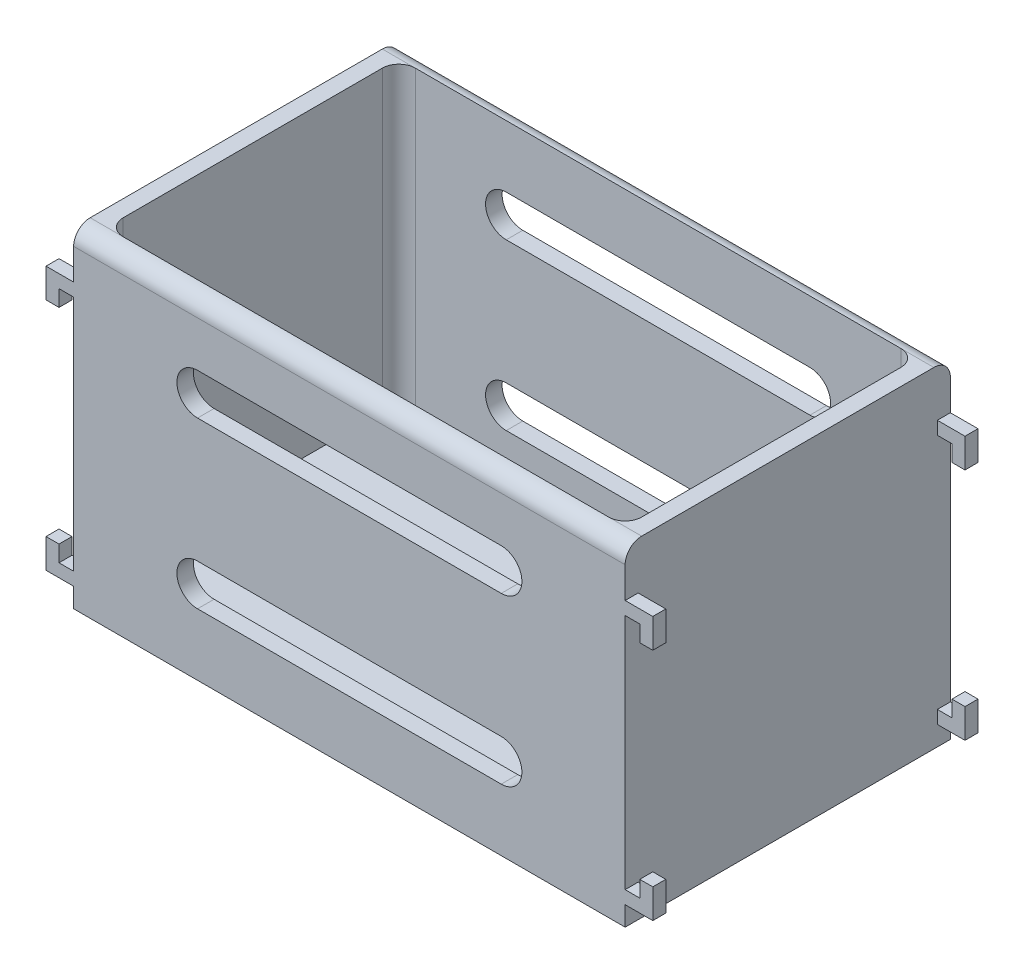
from build123d import *

# Parameters (mm, degrees)
SKETCH1_W           = 79.710080102
SKETCH1_H           = 44.920000076
BOSS_EXTRUDE1_DEPTH = 5
SKETCH3_W           = 84.790080102
SKETCH3_H           = 50.000000076
SKETCH3_W_2         = 79.710080102
SKETCH3_H_2         = 44.920000076
BOSS_EXTRUDE2_DEPTH = 50.8
SKETCH5_W           = 0.569871794
SKETCH5_H           = 4.640384615
CUT_EXTRUDE1_DEPTH  = 2.5
SKETCH6_R           = 2.5
CUT_EXTRUDE2_DEPTH  = 5
CUT_EXTRUDE3_REACH  = 84.934
SKETCH10_W          = 2.54
SKETCH10_H          = 50.000000076
BOSS_EXTRUDE3_DEPTH = 50.8
BOSS_EXTRUDE4_DEPTH = 2
FILLET1_R           = 2.54
FILLET2_R           = 2.54


with BuildPart() as part:
    # Sketch1 → Boss-Extrude1 (new body)
    with BuildSketch(Plane(origin=(0, 0, 0), x_dir=(1, 0, 0), z_dir=(0, 1, 0))):
        Rectangle(SKETCH1_W, SKETCH1_H)
    extrude(amount=BOSS_EXTRUDE1_DEPTH)

    # Sketch5 → Cut-Extrude1 (cut)
    # profile 1 of 12: a face of its own
    with BuildSketch(Plane(origin=(0, 5, 0), x_dir=(1, 0, 0), z_dir=(0, 1, 0))):
        Polygon((29.470512821, 0), (28.632241587, -6.35), (28.55083133, -6.35), (25.929166667, -1.13974359), (23.315134215, -6.35), (23.233723958, -6.35), (22.387820513, 0), (22.957692308, 0), (23.568269231, -4.565334535), (25.859204728, 0), (25.988952324, 0), (28.290064103, -4.579326923), (28.89682492, 0), align=None)
    # profile 2 of 12: a face of its own
    with BuildSketch(Plane(origin=(0, 5, 0), x_dir=(1, 0, 0), z_dir=(0, 1, 0))):
        with BuildLine():
            Line((21.736538462, -1.224969952), (21.199739583, -1.546794872))
            add(Edge.make_bspline(
                [(21.199739583, -1.546794872), (21.149813639, -1.463220916), (21.054157455, -1.303096443), (20.894588561, -1.086728284), (20.729247422, -0.902828371), (20.556909631, -0.752466525), (20.378627125, -0.634086402), (20.193236056, -0.550262353), (20.001361171, -0.497981941), (19.870780095, -0.491631784), (19.805588942, -0.488461538)],
                knots=[0, 0, 0, 0, 1.272034388, 2.437168799, 3.508375237, 4.49857839, 5.41946034, 6.295179144, 7.148887113, 8, 8, 8, 8], degree=3))
            add(Edge.make_bspline(
                [(19.805588942, -0.488461538), (19.749925475, -0.490049047), (19.639572521, -0.493196285), (19.476796888, -0.522215453), (19.319499794, -0.569690598), (19.169246778, -0.634048844), (19.030011604, -0.713157176), (18.905976866, -0.806447547), (18.80117612, -0.914217146), (18.714534328, -1.032580248), (18.646709699, -1.159066129), (18.59845086, -1.290559784), (18.567450428, -1.426223298), (18.563520017, -1.518221532), (18.561538462, -1.564603365)],
                knots=[0, 0, 0, 0, 1.095645842, 2.172120455, 3.244862764, 4.326153987, 5.384857088, 6.392105572, 7.372507978, 8.334705661, 9.272564127, 10.189475455, 11.087205874, 12, 12, 12, 12], degree=3))
            add(Edge.make_bspline(
                [(18.561538462, -1.564603365), (18.564155833, -1.617490839), (18.569456296, -1.72459374), (18.616169625, -1.882881854), (18.687498923, -2.040202672), (18.754540447, -2.137534062), (18.789232772, -2.187900641)],
                knots=[0, 0, 0, 0, 0.938992559, 1.901562324, 2.914110574, 4, 4, 4, 4], degree=3))
            add(Edge.make_bspline(
                [(18.789232772, -2.187900641), (18.817579078, -2.224350266), (18.877263282, -2.301096314), (18.981380183, -2.413329319), (19.099767658, -2.532163359), (19.235490804, -2.655226524), (19.386570485, -2.785036169), (19.55471952, -2.919184818), (19.737974506, -3.059673243), (19.867229586, -3.152461808), (19.934064503, -3.200440705)],
                knots=[0, 0, 0, 0, 0.722283655, 1.520795216, 2.39349503, 3.346893347, 4.386874146, 5.510198126, 6.712579003, 8, 8, 8, 8], degree=3))
            add(Edge.make_bspline(
                [(19.934064503, -3.200440705), (20.000864842, -3.248037749), (20.128582002, -3.339039672), (20.307329212, -3.473925777), (20.46695426, -3.598035897), (20.608270515, -3.709641224), (20.727621948, -3.813609417), (20.829371712, -3.904368361), (20.909765874, -3.986764482), (20.954503329, -4.04017337), (20.974589343, -4.064152644)],
                knots=[0, 0, 0, 0, 1.452255772, 2.776602448, 3.96446981, 5.032613149, 5.964194703, 6.766668629, 7.446264616, 8, 8, 8, 8], degree=3))
            add(Edge.make_bspline(
                [(20.974589343, -4.064152644), (21.002656256, -4.101530666), (21.057853606, -4.175039564), (21.130793263, -4.289902509), (21.192303475, -4.407259736), (21.241807695, -4.527536574), (21.281839882, -4.64982907), (21.309672522, -4.775055348), (21.326827973, -4.902365297), (21.328600082, -4.988021111), (21.329487179, -5.030899439)],
                knots=[0, 0, 0, 0, 1.068019517, 2.100403715, 3.106014851, 4.09224787, 5.069873182, 6.043214339, 7.020455327, 8, 8, 8, 8], degree=3))
            add(Edge.make_bspline(
                [(21.329487179, -5.030899439), (21.327129592, -5.098087786), (21.32246481, -5.231028377), (21.282688476, -5.425129368), (21.220648105, -5.611018437), (21.13088991, -5.784558367), (21.020021745, -5.945503151), (20.888421023, -6.090997768), (20.733623235, -6.216034114), (20.561293764, -6.322325004), (20.374868794, -6.407121426), (20.178947085, -6.468909412), (19.974409002, -6.505120944), (19.835411784, -6.510228772), (19.764883814, -6.512820513)],
                knots=[0, 0, 0, 0, 1.005367131, 1.989245246, 2.955191616, 3.932180104, 4.904534562, 5.875498653, 6.859376768, 7.874484044, 8.900379497, 9.918679785, 10.943926428, 12, 12, 12, 12], degree=3))
            add(Edge.make_bspline(
                [(19.764883814, -6.512820513), (19.690032107, -6.510322785), (19.541592221, -6.505369492), (19.3231803, -6.459653113), (19.111638503, -6.388621794), (18.942104354, -6.304024864), (18.809370098, -6.220443231), (18.708252401, -6.144120661), (18.605225534, -6.056444554), (18.501399571, -5.955557522), (18.395748686, -5.843480074), (18.288759783, -5.719262674), (18.179431554, -5.584024954), (18.109121303, -5.487456371), (18.073076923, -5.437950721)],
                knots=[0, 0, 0, 0, 1.286534051, 2.551350862, 3.822568981, 5.117864672, 5.799956111, 6.519305446, 7.295594771, 8.126302591, 9.008831062, 9.944975596, 10.946496709, 12, 12, 12, 12], degree=3))
            Line((18.073076923, -5.437950721), (18.588251202, -5.047435897))
            add(Edge.make_bspline(
                [(18.588251202, -5.047435897), (18.619356554, -5.087513413), (18.679258189, -5.164693338), (18.770237574, -5.272741859), (18.855857875, -5.371573495), (18.940860178, -5.457190486), (19.018692232, -5.536005119), (19.095575299, -5.602283407), (19.168539275, -5.65812948), (19.260299599, -5.717805785), (19.376835469, -5.775543051), (19.521758822, -5.825183338), (19.673307796, -5.855690238), (19.776191049, -5.859567625), (19.828485577, -5.861538462)],
                knots=[0, 0, 0, 0, 1.181426797, 2.275151783, 3.28963443, 4.225459815, 5.084396437, 5.868484344, 6.587427557, 7.222918358, 8.415355282, 9.605213164, 10.782753814, 12, 12, 12, 12], degree=3))
            add(Edge.make_bspline(
                [(19.828485577, -5.861538462), (19.894099319, -5.859376089), (20.020629241, -5.855206157), (20.199846181, -5.80846585), (20.362082236, -5.737400363), (20.50114407, -5.634924672), (20.615965271, -5.512753909), (20.700053234, -5.373426759), (20.750327949, -5.219545343), (20.756481487, -5.112253957), (20.759615385, -5.057612179)],
                knots=[0, 0, 0, 0, 1.144248881, 2.206576175, 3.214949548, 4.222996039, 5.203671638, 6.127710127, 7.046472867, 8, 8, 8, 8], degree=3))
            add(Edge.make_bspline(
                [(20.759615385, -5.057612179), (20.758827691, -5.023608381), (20.75724133, -4.955127098), (20.738328054, -4.854158657), (20.710103955, -4.754378849), (20.670097074, -4.655212794), (20.61572725, -4.553835339), (20.541883484, -4.450824316), (20.449477788, -4.343601627), (20.378558849, -4.273932591), (20.341115785, -4.237149439)],
                knots=[0, 0, 0, 0, 0.858500039, 1.728959331, 2.587258638, 3.476905708, 4.426389682, 5.487945037, 6.673710648, 8, 8, 8, 8], degree=3))
            add(Edge.make_bspline(
                [(20.341115785, -4.237149439), (20.327215867, -4.224745121), (20.294192842, -4.1952753), (20.233820805, -4.147029305), (20.154096014, -4.087515704), (20.057100306, -4.013878716), (19.941045236, -3.928459491), (19.805918041, -3.832350224), (19.653224974, -3.722430891), (19.544872356, -3.64558221), (19.487580128, -3.604947917)],
                knots=[0, 0, 0, 0, 0.420754252, 0.999615792, 1.744751191, 2.668019286, 3.750313428, 4.999500688, 6.413464383, 8, 8, 8, 8], degree=3))
            add(Edge.make_bspline(
                [(19.487580128, -3.604947917), (19.418662877, -3.554798557), (19.285214172, -3.457691274), (19.095334762, -3.311794734), (18.923172534, -3.16910357), (18.7681103, -3.03053828), (18.628658817, -2.897118954), (18.506223838, -2.767343875), (18.400249846, -2.64206409), (18.284603189, -2.482539836), (18.167834347, -2.284803684), (18.067714662, -2.042430398), (18.004020233, -1.799361576), (17.995748084, -1.636201224), (17.991666667, -1.555699119)],
                knots=[0, 0, 0, 0, 1.163604038, 2.253157948, 3.268574773, 4.215621239, 5.091738613, 5.902582348, 6.650434646, 7.330118262, 8.591011492, 9.77460283, 10.902005569, 12, 12, 12, 12], degree=3))
            add(Edge.make_bspline(
                [(17.991666667, -1.555699119), (17.992860781, -1.498770851), (17.995225821, -1.386019825), (18.022341884, -1.220441743), (18.062211983, -1.059696922), (18.121633568, -0.905785758), (18.195912275, -0.756992899), (18.286346008, -0.613579235), (18.395941395, -0.477901206), (18.517688721, -0.347323906), (18.652919196, -0.229229648), (18.796020651, -0.124044948), (18.946189888, -0.03398346), (19.105141814, 0.036770844), (19.270258058, 0.093368238), (19.442313689, 0.133935761), (19.621678419, 0.158918548), (19.743601055, 0.161505338), (19.805588942, 0.162820513)],
                knots=[0, 0, 0, 0, 0.98378539, 1.948466333, 2.894822735, 3.844243623, 4.795447569, 5.768042124, 6.770299647, 7.807997672, 8.852593179, 9.870666288, 10.876941106, 11.874841786, 12.874492863, 13.892063892, 14.928283473, 16, 16, 16, 16], degree=3))
            add(Edge.make_bspline(
                [(19.805588942, 0.162820513), (19.853548091, 0.161882456), (19.948862391, 0.160018158), (20.089465358, 0.143927021), (20.227486419, 0.120329164), (20.361192596, 0.084351012), (20.492248617, 0.03967175), (20.619486869, -0.01503113), (20.743214289, -0.080153669), (20.863583714, -0.155796598), (20.981696865, -0.242995133), (21.097077053, -0.343675031), (21.210301867, -0.457354378), (21.32184163, -0.583874975), (21.429068881, -0.72532812), (21.534680065, -0.879470532), (21.638125261, -1.046800186), (21.703121344, -1.164470751), (21.736538462, -1.224969952)],
                knots=[0, 0, 0, 0, 0.915366252, 1.81920441, 2.69897508, 3.586533125, 4.459536084, 5.340758185, 6.227946952, 7.126403341, 8.052553006, 9.028121456, 10.047063623, 11.114014537, 12.24582441, 13.433687931, 14.680555077, 16, 16, 16, 16], degree=3))
        make_face()
    # profile 3 of 12: a face of its own
    with BuildSketch(Plane(origin=(0, 5, 0), x_dir=(1, 0, 0), z_dir=(0, 1, 0))):
        Polygon((17.096153846, -6.35), (16.508473558, -6.35), (15.264423077, -1.689262821), (13.417427885, -6.35), (13.334745593, -6.35), (11.519551282, -1.724879808), (10.27041266, -6.35), (9.687820513, -6.35), (11.399979968, 0), (11.481390224, 0), (13.391987179, -4.854086538), (15.322936699, 0), (15.40561899, 0), align=None)
    # profile 4 of 12: a face of its own
    with BuildSketch(Plane(origin=(0, 5, 0), x_dir=(1, 0, 0), z_dir=(0, 1, 0))):
        with BuildLine():
            Line((5.780128205, -6.35), (4.509364984, -6.35))
            add(Edge.make_bspline(
                [(4.509364984, -6.35), (4.424563222, -6.349717723), (4.261734446, -6.349175719), (4.028465798, -6.346153549), (3.816508065, -6.337491503), (3.625972071, -6.330037359), (3.456861311, -6.316444837), (3.308657227, -6.303453377), (3.182042404, -6.286446878), (3.105396359, -6.270652754), (3.070693109, -6.263501603)],
                knots=[0, 0, 0, 0, 1.410062039, 2.707475311, 3.878576406, 4.937260626, 5.877586885, 6.699081471, 7.410979367, 8, 8, 8, 8], degree=3))
            add(Edge.make_bspline(
                [(3.070693109, -6.263501603), (3.024234594, -6.252024314), (2.932308651, -6.229314577), (2.799967737, -6.181290862), (2.673807024, -6.125806144), (2.554288517, -6.060139528), (2.441443534, -5.985399876), (2.335283444, -5.901286733), (2.237231645, -5.807079422), (2.143799605, -5.706680378), (2.062215587, -5.595718353), (1.988768329, -5.479824374), (1.927111872, -5.356767193), (1.878595121, -5.227167484), (1.837922108, -5.092296552), (1.810586046, -4.950821691), (1.793560668, -4.803203189), (1.79187856, -4.702761998), (1.791025641, -4.651832933)],
                knots=[0, 0, 0, 0, 1.027276577, 2.032638556, 3.019345632, 3.985365262, 4.957888996, 5.923693931, 6.890056973, 7.876427719, 8.865527834, 9.843495157, 10.821038291, 11.815616373, 12.812734995, 13.843357168, 14.906466538, 16, 16, 16, 16], degree=3))
            add(Edge.make_bspline(
                [(1.791025641, -4.651832933), (1.793690754, -4.567223431), (1.79889108, -4.40212838), (1.84737902, -4.162533569), (1.926798601, -3.939027982), (2.036255299, -3.731922661), (2.175579604, -3.545145539), (2.343015737, -3.381647967), (2.537708612, -3.243566818), (2.719805847, -3.14883098), (2.880737315, -3.087873881), (3.013615002, -3.044768934), (3.15867216, -3.012026562), (3.313827723, -2.982268321), (3.480280128, -2.959560392), (3.657694182, -2.943433447), (3.846513607, -2.933063698), (3.975944318, -2.931548634), (4.042528045, -2.930769231)],
                knots=[0, 0, 0, 0, 1.260402266, 2.459371274, 3.627181936, 4.786749125, 5.93865593, 7.087644312, 8.261344208, 9.485713728, 10.136162886, 10.825977872, 11.566646758, 12.35154167, 13.181268117, 14.0701832, 15.007234106, 16, 16, 16, 16], degree=3))
            Line((4.042528045, -2.930769231), (1.709615385, 0))
            Line((1.709615385, 0), (2.414322917, 0))
            Line((2.414322917, 0), (4.747235577, -2.930769231))
            Line((4.747235577, -2.930769231), (5.21025641, -2.930769231))
            Line((5.21025641, -2.930769231), (5.21025641, 0))
            Line((5.21025641, 0), (5.780128205, 0))
            Line((5.780128205, 0), (5.780128205, -6.35))
        make_face()
        with BuildLine():
            Line((5.21025641, -5.698717949), (5.21025641, -3.582051282))
            Line((5.21025641, -3.582051282), (4.047616186, -3.573147035))
            add(Edge.make_bspline(
                [(4.047616186, -3.573147035), (3.99333268, -3.573123006), (3.888115784, -3.573076432), (3.735896099, -3.580322469), (3.594163582, -3.588564712), (3.463462126, -3.60117493), (3.343727468, -3.617416838), (3.235038694, -3.637764967), (3.137155615, -3.661371121), (3.023358823, -3.698281165), (2.894825158, -3.754237002), (2.758018362, -3.84100139), (2.638384738, -3.94593013), (2.538922588, -4.067431981), (2.459034475, -4.201595134), (2.403545065, -4.345383279), (2.366977868, -4.496530892), (2.362947614, -4.600311874), (2.360897436, -4.653104968)],
                knots=[0, 0, 0, 0, 1.146399208, 2.222048177, 3.218135709, 4.144938032, 4.994811973, 5.769438708, 6.479732432, 7.119818093, 8.294689872, 9.430121864, 10.527913442, 11.641375077, 12.733452768, 13.811150417, 14.886538365, 16, 16, 16, 16], degree=3))
            add(Edge.make_bspline(
                [(2.360897436, -4.653104968), (2.363051422, -4.704180881), (2.367319838, -4.805394704), (2.402962837, -4.953235646), (2.461162209, -5.093812978), (2.540822212, -5.225192265), (2.639967628, -5.343566857), (2.755449709, -5.444540554), (2.884550904, -5.528426623), (3.004236112, -5.583774855), (3.111994949, -5.616341841), (3.205125032, -5.639982181), (3.311271521, -5.656538803), (3.429185087, -5.671766473), (3.559383715, -5.684661976), (3.701946749, -5.693221376), (3.856772254, -5.698337343), (3.964081656, -5.698588128), (4.01963141, -5.698717949)],
                knots=[0, 0, 0, 0, 1.100596872, 2.180981401, 3.259506136, 4.371595435, 5.481727359, 6.576991111, 7.667816242, 8.793363246, 9.406619729, 10.09427138, 10.864108636, 11.721733836, 12.6590937, 13.685439239, 14.801845161, 16, 16, 16, 16], degree=3))
            Line((4.01963141, -5.698717949), (5.21025641, -5.698717949))
        make_face(mode=Mode.SUBTRACT)
    # profile 5 of 12: a face of its own
    with BuildSketch(Plane(origin=(0, 5, 0), x_dir=(1, 0, 0), z_dir=(0, 1, 0))):
        with BuildLine():
            add(Edge.make_bspline(
                [(-1.671454327, -4.721794872), (-1.758526369, -4.71994631), (-1.929253364, -4.716321733), (-2.179245636, -4.677391821), (-2.417631399, -4.618357095), (-2.645433255, -4.535258039), (-2.860766824, -4.426228833), (-3.065554681, -4.294380077), (-3.259386523, -4.138819744), (-3.375537746, -4.018417111), (-3.434495192, -3.957301683)],
                knots=[0, 0, 0, 0, 1.054042676, 2.066720093, 3.05716247, 4.025731183, 4.997454851, 5.974904663, 6.97207755, 8, 8, 8, 8], degree=3))
            add(Edge.make_bspline(
                [(-3.434495192, -3.957301683), (-3.485262452, -3.898856308), (-3.585814485, -3.783096639), (-3.714748003, -3.595398598), (-3.825821405, -3.401015844), (-3.914835634, -3.197367123), (-3.98502132, -2.98623022), (-4.03485194, -2.766879428), (-4.064491808, -2.53979917), (-4.068488619, -2.385577921), (-4.070512821, -2.307471955)],
                knots=[0, 0, 0, 0, 1.025258237, 2.030674902, 3.01204498, 3.988269485, 4.97094183, 5.956517959, 6.965070386, 8, 8, 8, 8], degree=3))
            add(Edge.make_bspline(
                [(-4.070512821, -2.307471955), (-4.068732394, -2.228913279), (-4.065214189, -2.073677671), (-4.031933627, -1.845042538), (-3.980170089, -1.62334621), (-3.906089457, -1.40951689), (-3.811096928, -1.202900812), (-3.695180809, -1.004400979), (-3.557528626, -0.813623622), (-3.401490446, -0.632196921), (-3.229047977, -0.464961659), (-3.041933983, -0.31929354), (-2.843689924, -0.193969), (-2.631609573, -0.094426469), (-2.408711825, -0.014188256), (-2.173578913, 0.041141156), (-1.926420593, 0.074893599), (-1.75763858, 0.079207482), (-1.671454327, 0.081410256)],
                knots=[0, 0, 0, 0, 0.998669827, 1.973418153, 2.932281609, 3.89081133, 4.846438734, 5.82045571, 6.809776312, 7.834649874, 8.860672198, 9.859676908, 10.845817165, 11.837296335, 12.833502054, 13.853824644, 14.904110009, 16, 16, 16, 16], degree=3))
            add(Edge.make_bspline(
                [(-1.671454327, 0.081410256), (-1.584851967, 0.079189256), (-1.415236871, 0.074839314), (-1.167147896, 0.041392226), (-0.931025001, -0.014779428), (-0.707072895, -0.093433137), (-0.494993404, -0.194786611), (-0.296017326, -0.318805914), (-0.108815074, -0.465035422), (0.063681459, -0.632176934), (0.219705144, -0.813628772), (0.357361067, -1.004399642), (0.473276215, -1.20290116), (0.568268998, -1.409516797), (0.642349561, -1.623346235), (0.694113118, -1.845042531), (0.727393675, -2.073677673), (0.730911881, -2.22891328), (0.732692308, -2.307471955)],
                knots=[0, 0, 0, 0, 1.099861214, 2.154133753, 3.1731438, 4.178222029, 5.163564916, 6.153006591, 7.15072618, 8.175428628, 9.198983792, 10.187031731, 11.15979573, 12.114193814, 13.071490482, 14.029120454, 15.002614863, 16, 16, 16, 16], degree=3))
            add(Edge.make_bspline(
                [(0.732692308, -2.307471955), (0.730659144, -2.385155136), (0.726633828, -2.538954483), (0.696953512, -2.765582717), (0.647665087, -2.984262168), (0.576506426, -3.194246094), (0.487657435, -3.39740535), (0.377701939, -3.592500816), (0.247521204, -3.779378695), (0.147359814, -3.894984854), (0.096674679, -3.953485577)],
                knots=[0, 0, 0, 0, 1.031377469, 2.041950136, 3.029500481, 4.003457997, 4.981637986, 5.969878303, 6.97268806, 8, 8, 8, 8], degree=3))
            add(Edge.make_bspline(
                [(0.096674679, -3.953485577), (0.037801239, -4.015120719), (-0.077983741, -4.13633707), (-0.272710339, -4.291590475), (-0.476617269, -4.425216869), (-0.693339813, -4.534191206), (-0.921775089, -4.618206319), (-1.161932583, -4.677667354), (-1.412834776, -4.716149535), (-1.584388685, -4.719894339), (-1.671454327, -4.721794872)],
                knots=[0, 0, 0, 0, 1.027951202, 2.021646915, 2.998468564, 3.9668038, 4.943370589, 5.93035926, 6.949632805, 8, 8, 8, 8], degree=3))
        make_face()
        with BuildLine():
            add(Edge.make_bspline(
                [(-1.668910256, -4.151923077), (-1.607337802, -4.150172937), (-1.485782376, -4.146717838), (-1.306857277, -4.120441261), (-1.134612394, -4.078802887), (-0.968699001, -4.019668415), (-0.809758639, -3.943218761), (-0.657617009, -3.849848655), (-0.512680642, -3.739061807), (-0.376071558, -3.613056321), (-0.249201122, -3.476204149), (-0.139665681, -3.329003242), (-0.045827497, -3.175543881), (0.03084597, -3.014958699), (0.089669404, -2.846806514), (0.131347661, -2.672049409), (0.157674106, -2.49016726), (0.161086459, -2.366499854), (0.162820513, -2.303655849)],
                knots=[0, 0, 0, 0, 1.021608339, 2.016844023, 2.99486249, 3.958675159, 4.934437641, 5.916902129, 6.916234728, 7.957219854, 8.998204981, 10.008773588, 10.997243553, 11.979355116, 12.956436335, 13.948132639, 14.957303585, 16, 16, 16, 16], degree=3))
            add(Edge.make_bspline(
                [(0.162820513, -2.303655849), (0.159912968, -2.222459298), (0.154142036, -2.061299326), (0.106974988, -1.824023336), (0.028628321, -1.595803479), (-0.079406483, -1.379387583), (-0.212454595, -1.178804638), (-0.368027075, -0.998439508), (-0.548274767, -0.845247795), (-0.74705989, -0.716410985), (-0.961565407, -0.614952119), (-1.188195042, -0.54219262), (-1.424885263, -0.495531333), (-1.586856701, -0.490838761), (-1.668910256, -0.488461538)],
                knots=[0, 0, 0, 0, 1.016977094, 2.018509362, 3.018404954, 4.033172147, 5.041280572, 6.028085189, 7.007940189, 7.995502847, 8.989109012, 9.972200833, 10.97273166, 12, 12, 12, 12], degree=3))
            add(Edge.make_bspline(
                [(-1.668910256, -0.488461538), (-1.750968531, -0.490824991), (-1.912949286, -0.49549038), (-2.149968831, -0.542429022), (-2.377219585, -0.614635735), (-2.591948133, -0.716525577), (-2.790823784, -0.844760826), (-2.969784383, -0.999312227), (-3.126696633, -1.178330491), (-3.259876486, -1.379121624), (-3.366170551, -1.596139924), (-3.444885659, -1.823981285), (-3.491939588, -2.061310036), (-3.497725788, -2.222462886), (-3.500641026, -2.303655849)],
                knots=[0, 0, 0, 0, 1.027082318, 2.027431966, 3.015401697, 4.008827937, 4.996211763, 5.971861488, 6.96198607, 7.969911943, 8.982141629, 9.981856156, 10.983207064, 12, 12, 12, 12], degree=3))
            add(Edge.make_bspline(
                [(-3.500641026, -2.303655849), (-3.498919963, -2.366504905), (-3.495533173, -2.490182252), (-3.469020792, -2.671992097), (-3.427996733, -2.847154557), (-3.366637148, -3.014280527), (-3.292634969, -3.176325623), (-3.19652179, -3.328543654), (-3.087496267, -3.476297525), (-2.960393261, -3.612973879), (-2.823799511, -3.739522184), (-2.677774319, -3.849445084), (-2.525562027, -3.94327208), (-2.366571437, -4.019677831), (-2.201033497, -4.078575276), (-2.029311559, -4.120622644), (-1.851178825, -4.146622031), (-1.730055032, -4.15014476), (-1.668910256, -4.151923077)],
                knots=[0, 0, 0, 0, 1.043037354, 2.052538279, 3.044558847, 4.0243144, 5.003741121, 5.996211188, 7.007110229, 8.048435736, 9.089761243, 10.095031504, 11.077817236, 12.053898772, 13.018026588, 13.989527945, 14.985089051, 16, 16, 16, 16], degree=3))
        make_face(mode=Mode.SUBTRACT)
    # profile 6 of 12: a face of its own
    with BuildSketch(Plane(origin=(0, 5, 0), x_dir=(1, 0, 0), z_dir=(0, 1, 0))):
        with BuildLine():
            Line((-5.21025641, 0), (-5.21025641, -6.512820513))
            Line((-5.21025641, -6.512820513), (-5.780128205, -6.512820513))
            Line((-5.780128205, -6.512820513), (-5.780128205, -3.798297276))
            add(Edge.make_bspline(
                [(-5.780128205, -3.798297276), (-5.843776655, -3.872395389), (-5.968339424, -4.017408601), (-6.179608945, -4.203955154), (-6.398914893, -4.365602362), (-6.631657553, -4.495564741), (-6.875795503, -4.597293962), (-7.131068285, -4.669543466), (-7.398265809, -4.714459666), (-7.580303271, -4.71932141), (-7.672916667, -4.721794872)],
                knots=[0, 0, 0, 0, 1.073845349, 2.101561798, 3.093746447, 4.06731023, 5.027507813, 5.99794647, 6.981435071, 8, 8, 8, 8], degree=3))
            add(Edge.make_bspline(
                [(-7.672916667, -4.721794872), (-7.754862863, -4.719549822), (-7.91688446, -4.715110976), (-8.155040068, -4.681229295), (-8.383920492, -4.626768238), (-8.603575364, -4.549836968), (-8.813886139, -4.450021363), (-9.015587964, -4.328833904), (-9.20771524, -4.185147253), (-9.387406841, -4.020749864), (-9.553091375, -3.842330402), (-9.69789903, -3.65142231), (-9.820906173, -3.451434754), (-9.91985849, -3.241052446), (-10.000599692, -3.022860566), (-10.053939134, -2.793735021), (-10.088394822, -2.555718004), (-10.092688824, -2.393669684), (-10.094871795, -2.311288061)],
                knots=[0, 0, 0, 0, 1.034424137, 2.045232812, 3.030843571, 4.001080581, 4.978206309, 5.965255608, 6.967506581, 8.002193933, 9.036548792, 10.037741014, 11.022988172, 11.995276286, 12.96911093, 13.954721688, 14.960227752, 16, 16, 16, 16], degree=3))
            add(Edge.make_bspline(
                [(-10.094871795, -2.311288061), (-10.092628539, -2.230189457), (-10.08820519, -2.070275783), (-10.054420817, -1.834951031), (-9.998638308, -1.608457963), (-9.918880161, -1.391381839), (-9.818613772, -1.182702853), (-9.693226172, -0.984799834), (-9.548426216, -0.794229121), (-9.380911132, -0.617111961), (-9.199639401, -0.453402792), (-9.005666417, -0.311152151), (-8.803878074, -0.188293948), (-8.591129284, -0.090947636), (-8.370570124, -0.012205964), (-8.139837636, 0.042436132), (-7.900237208, 0.074318675), (-7.73746151, 0.079027775), (-7.655108173, 0.081410256)],
                knots=[0, 0, 0, 0, 1.024244038, 2.01964794, 2.996620209, 3.965911562, 4.936179293, 5.91563013, 6.920572822, 7.955171681, 8.990768464, 10.002129126, 10.989675881, 11.969873457, 12.952483066, 13.943799762, 14.959703725, 16, 16, 16, 16], degree=3))
            add(Edge.make_bspline(
                [(-7.655108173, 0.081410256), (-7.560825356, 0.078803469), (-7.375953192, 0.073692014), (-7.105575096, 0.031105932), (-6.849823651, -0.040752362), (-6.606564114, -0.138948457), (-6.376042956, -0.268527906), (-6.161037434, -0.432965841), (-5.958301151, -0.629394023), (-5.840663303, -0.780741902), (-5.780128205, -0.858623798)],
                knots=[0, 0, 0, 0, 1.035773977, 2.030972173, 2.998803062, 3.949817361, 4.907566521, 5.895483014, 6.917039511, 8, 8, 8, 8], degree=3))
            Line((-5.780128205, -0.858623798), (-5.780128205, 0))
            Line((-5.780128205, 0), (-5.21025641, 0))
        make_face()
        with BuildLine():
            add(Edge.make_bspline(
                [(-7.650020032, -0.488461538), (-7.733321758, -0.491425424), (-7.897746116, -0.497275664), (-8.139125963, -0.542947571), (-8.370108819, -0.618938212), (-8.589539749, -0.722863875), (-8.793951362, -0.85354485), (-8.976641125, -1.011606941), (-9.139087086, -1.192743542), (-9.275756364, -1.396114524), (-9.386811329, -1.613847007), (-9.465454392, -1.840770456), (-9.517157196, -2.07363485), (-9.522374341, -2.23172517), (-9.525, -2.311288061)],
                knots=[0, 0, 0, 0, 1.031914401, 2.036834895, 3.032257342, 4.038331338, 5.038293177, 6.02950375, 7.023204684, 8.044926225, 9.057839131, 10.043391864, 11.01528823, 12, 12, 12, 12], degree=3))
            add(Edge.make_bspline(
                [(-9.525, -2.311288061), (-9.521606529, -2.390792645), (-9.514833133, -2.549484409), (-9.466539365, -2.784405773), (-9.384885247, -3.012753256), (-9.273798873, -3.23275902), (-9.134662804, -3.437021811), (-8.973387583, -3.621591897), (-8.788448252, -3.780381998), (-8.583780467, -3.91282543), (-8.365732286, -4.020878513), (-8.136243971, -4.094984364), (-7.900099469, -4.143494734), (-7.739724854, -4.149099341), (-7.658924279, -4.151923077)],
                knots=[0, 0, 0, 0, 0.984698701, 1.96546623, 2.957354799, 3.98164001, 5.010280354, 6.011473015, 7.009725998, 8.019440419, 9.024964737, 10.015029379, 10.999924227, 12, 12, 12, 12], degree=3))
            add(Edge.make_bspline(
                [(-7.658924279, -4.151923077), (-7.576433377, -4.149100832), (-7.412705675, -4.143499249), (-7.171098296, -4.094900372), (-6.935134721, -4.020420998), (-6.709609629, -3.913530478), (-6.499534794, -3.782597637), (-6.311354111, -3.629401429), (-6.151201875, -3.453000975), (-6.016697688, -3.25768952), (-5.911404067, -3.044510437), (-5.834006092, -2.817706972), (-5.788904039, -2.57723079), (-5.783089078, -2.412814389), (-5.780128205, -2.329096554)],
                knots=[0, 0, 0, 0, 1.016923665, 2.018387129, 3.029331102, 4.063827766, 5.088687889, 6.077443098, 7.047726765, 8.018574484, 8.994259598, 9.972060545, 10.967410195, 12, 12, 12, 12], degree=3))
            add(Edge.make_bspline(
                [(-5.780128205, -2.329096554), (-5.781868909, -2.264983397), (-5.785295164, -2.138788415), (-5.811481876, -1.953503291), (-5.853108406, -1.776174044), (-5.911867351, -1.606687232), (-5.988528305, -1.446038182), (-6.082298712, -1.293706887), (-6.192322926, -1.148962829), (-6.318636788, -1.014489325), (-6.456803162, -0.891783993), (-6.603029676, -0.782269052), (-6.75901838, -0.692300053), (-6.922153922, -0.617839672), (-7.092717249, -0.558586585), (-7.272096828, -0.519057499), (-7.45838584, -0.491915198), (-7.585469399, -0.48962488), (-7.650020032, -0.488461538)],
                knots=[0, 0, 0, 0, 1.050530046, 2.067775578, 3.06063298, 4.032099092, 5.001972962, 5.972195357, 6.959075678, 7.976890803, 8.990926413, 9.984756252, 10.965746163, 11.936043227, 12.920645196, 13.918694108, 14.942824589, 16, 16, 16, 16], degree=3))
        make_face(mode=Mode.SUBTRACT)
    # profile 7 of 12: a face of its own
    with BuildSketch(Plane(origin=(0, 5, 0), x_dir=(1, 0, 0), z_dir=(0, 1, 0))):
        with BuildLine():
            add(Edge.make_bspline(
                [(-13.475941506, -4.721794872), (-13.563013549, -4.71994631), (-13.733740544, -4.716321733), (-13.983732816, -4.677391821), (-14.222118578, -4.618357095), (-14.449920434, -4.535258039), (-14.665254004, -4.426228833), (-14.87004186, -4.294380077), (-15.063873703, -4.138819744), (-15.180024926, -4.018417111), (-15.238982372, -3.957301683)],
                knots=[0, 0, 0, 0, 1.054042676, 2.066720093, 3.05716247, 4.025731183, 4.997454851, 5.974904663, 6.97207755, 8, 8, 8, 8], degree=3))
            add(Edge.make_bspline(
                [(-15.238982372, -3.957301683), (-15.289749631, -3.898856308), (-15.390301664, -3.783096639), (-15.519235182, -3.595398598), (-15.630308584, -3.401015844), (-15.719322814, -3.197367123), (-15.789508499, -2.98623022), (-15.83933912, -2.766879428), (-15.868978987, -2.53979917), (-15.872975799, -2.385577921), (-15.875, -2.307471955)],
                knots=[0, 0, 0, 0, 1.025258237, 2.030674902, 3.01204498, 3.988269485, 4.97094183, 5.956517959, 6.965070386, 8, 8, 8, 8], degree=3))
            add(Edge.make_bspline(
                [(-15.875, -2.307471955), (-15.873219574, -2.228913279), (-15.869701369, -2.073677671), (-15.836420807, -1.845042538), (-15.784657268, -1.62334621), (-15.710576636, -1.40951689), (-15.615584108, -1.202900812), (-15.499667988, -1.004400979), (-15.362015805, -0.813623622), (-15.205977626, -0.632196921), (-15.033535156, -0.464961659), (-14.846421163, -0.31929354), (-14.648177104, -0.193969), (-14.436096752, -0.094426469), (-14.213199005, -0.014188256), (-13.978066092, 0.041141156), (-13.730907773, 0.074893599), (-13.562125759, 0.079207482), (-13.475941506, 0.081410256)],
                knots=[0, 0, 0, 0, 0.998669827, 1.973418153, 2.932281609, 3.89081133, 4.846438734, 5.82045571, 6.809776312, 7.834649874, 8.860672198, 9.859676908, 10.845817165, 11.837296335, 12.833502054, 13.853824644, 14.904110009, 16, 16, 16, 16], degree=3))
            add(Edge.make_bspline(
                [(-13.475941506, 0.081410256), (-13.389339147, 0.079189256), (-13.219724051, 0.074839314), (-12.971635076, 0.041392226), (-12.73551218, -0.014779428), (-12.511560075, -0.093433137), (-12.299480583, -0.194786611), (-12.100504505, -0.318805914), (-11.913302253, -0.465035422), (-11.74080572, -0.632176934), (-11.584782036, -0.813628772), (-11.447126113, -1.004399642), (-11.331210965, -1.20290116), (-11.236218182, -1.409516797), (-11.162137618, -1.623346235), (-11.110374061, -1.845042531), (-11.077093504, -2.073677673), (-11.073575298, -2.22891328), (-11.071794872, -2.307471955)],
                knots=[0, 0, 0, 0, 1.099861214, 2.154133753, 3.1731438, 4.178222029, 5.163564916, 6.153006591, 7.15072618, 8.175428628, 9.198983792, 10.187031731, 11.15979573, 12.114193814, 13.071490482, 14.029120454, 15.002614863, 16, 16, 16, 16], degree=3))
            add(Edge.make_bspline(
                [(-11.071794872, -2.307471955), (-11.073828036, -2.385155136), (-11.077853351, -2.538954483), (-11.107533668, -2.765582717), (-11.156822093, -2.984262168), (-11.227980753, -3.194246094), (-11.316829745, -3.39740535), (-11.426785241, -3.592500816), (-11.556965975, -3.779378695), (-11.657127365, -3.894984854), (-11.7078125, -3.953485577)],
                knots=[0, 0, 0, 0, 1.031377469, 2.041950136, 3.029500481, 4.003457997, 4.981637986, 5.969878303, 6.97268806, 8, 8, 8, 8], degree=3))
            add(Edge.make_bspline(
                [(-11.7078125, -3.953485577), (-11.76668594, -4.015120719), (-11.88247092, -4.13633707), (-12.077197518, -4.291590475), (-12.281104448, -4.425216869), (-12.497826993, -4.534191206), (-12.726262269, -4.618206319), (-12.966419762, -4.677667354), (-13.217321956, -4.716149535), (-13.388875865, -4.719894339), (-13.475941506, -4.721794872)],
                knots=[0, 0, 0, 0, 1.027951202, 2.021646915, 2.998468564, 3.9668038, 4.943370589, 5.93035926, 6.949632805, 8, 8, 8, 8], degree=3))
        make_face()
        with BuildLine():
            add(Edge.make_bspline(
                [(-13.473397436, -4.151923077), (-13.411824982, -4.150172937), (-13.290269556, -4.146717838), (-13.111344456, -4.120441261), (-12.939099574, -4.078802887), (-12.77318618, -4.019668415), (-12.614245818, -3.943218761), (-12.462104188, -3.849848655), (-12.317167822, -3.739061807), (-12.180558738, -3.613056321), (-12.053688301, -3.476204149), (-11.94415286, -3.329003242), (-11.850314677, -3.175543881), (-11.773641209, -3.014958699), (-11.714817776, -2.846806514), (-11.673139518, -2.672049409), (-11.646813073, -2.49016726), (-11.64340072, -2.366499854), (-11.641666667, -2.303655849)],
                knots=[0, 0, 0, 0, 1.021608339, 2.016844023, 2.99486249, 3.958675159, 4.934437641, 5.916902129, 6.916234728, 7.957219854, 8.998204981, 10.008773588, 10.997243553, 11.979355116, 12.956436335, 13.948132639, 14.957303585, 16, 16, 16, 16], degree=3))
            add(Edge.make_bspline(
                [(-11.641666667, -2.303655849), (-11.644574211, -2.222459298), (-11.650345143, -2.061299326), (-11.697512192, -1.824023336), (-11.775858858, -1.595803479), (-11.883893663, -1.379387583), (-12.016941774, -1.178804638), (-12.172514255, -0.998439508), (-12.352761946, -0.845247795), (-12.55154707, -0.716410985), (-12.766052587, -0.614952119), (-12.992682222, -0.54219262), (-13.229372442, -0.495531333), (-13.391343881, -0.490838761), (-13.473397436, -0.488461538)],
                knots=[0, 0, 0, 0, 1.016977094, 2.018509362, 3.018404954, 4.033172147, 5.041280572, 6.028085189, 7.007940189, 7.995502847, 8.989109012, 9.972200833, 10.97273166, 12, 12, 12, 12], degree=3))
            add(Edge.make_bspline(
                [(-13.473397436, -0.488461538), (-13.555455711, -0.490824991), (-13.717436466, -0.49549038), (-13.954456011, -0.542429022), (-14.181706765, -0.614635735), (-14.396435313, -0.716525577), (-14.595310963, -0.844760826), (-14.774271563, -0.999312227), (-14.931183812, -1.178330491), (-15.064363666, -1.379121624), (-15.170657731, -1.596139924), (-15.249372838, -1.823981285), (-15.296426767, -2.061310036), (-15.302212968, -2.222462886), (-15.305128205, -2.303655849)],
                knots=[0, 0, 0, 0, 1.027082318, 2.027431966, 3.015401697, 4.008827937, 4.996211763, 5.971861488, 6.96198607, 7.969911943, 8.982141629, 9.981856156, 10.983207064, 12, 12, 12, 12], degree=3))
            add(Edge.make_bspline(
                [(-15.305128205, -2.303655849), (-15.303407142, -2.366504905), (-15.300020353, -2.490182252), (-15.273507971, -2.671992097), (-15.232483913, -2.847154557), (-15.171124328, -3.014280527), (-15.097122148, -3.176325623), (-15.00100897, -3.328543654), (-14.891983447, -3.476297525), (-14.76488044, -3.612973879), (-14.62828669, -3.739522184), (-14.482261498, -3.849445084), (-14.330049206, -3.94327208), (-14.171058616, -4.019677831), (-14.005520676, -4.078575276), (-13.833798739, -4.120622644), (-13.655666004, -4.146622031), (-13.534542212, -4.15014476), (-13.473397436, -4.151923077)],
                knots=[0, 0, 0, 0, 1.043037354, 2.052538279, 3.044558847, 4.0243144, 5.003741121, 5.996211188, 7.007110229, 8.048435736, 9.089761243, 10.095031504, 11.077817236, 12.053898772, 13.018026588, 13.989527945, 14.985089051, 16, 16, 16, 16], degree=3))
        make_face(mode=Mode.SUBTRACT)
    # profile 8 of 12: a face of its own
    with BuildSketch(Plane(origin=(0, 5, 0), x_dir=(1, 0, 0), z_dir=(0, 1, 0))):
        Polygon((-17.584615385, -6.512820513), (-18.154487179, -6.512820513), (-18.154487179, -4.640384615), (-18.968589744, -4.640384615), (-18.968589744, -4.070512821), (-18.154487179, -4.070512821), (-18.154487179, 0), (-17.584615385, 0), (-17.584615385, -4.070512821), (-16.770512821, -4.070512821), (-16.770512821, -4.640384615), (-17.584615385, -4.640384615), align=None)
    # profile 9 of 12: a face of its own
    with BuildSketch(Plane(origin=(0, 5, 0), x_dir=(1, 0, 0), z_dir=(0, 1, 0))):
        with BuildLine():
            add(Edge.make_bspline(
                [(-20.227904647, -6.594230769), (-20.263261559, -6.592583263), (-20.332497182, -6.589357129), (-20.432717406, -6.561950947), (-20.523883079, -6.514787187), (-20.605951552, -6.453567477), (-20.673982543, -6.378610047), (-20.722764385, -6.293441839), (-20.753906564, -6.200722985), (-20.757689373, -6.136118463), (-20.759615385, -6.10322516)],
                knots=[0, 0, 0, 0, 1.054986045, 2.065865298, 3.074122704, 4.105114675, 5.109626121, 6.074217918, 7.019490725, 8, 8, 8, 8], degree=3))
            add(Edge.make_bspline(
                [(-20.759615385, -6.10322516), (-20.757646286, -6.071185665), (-20.753753612, -6.007847376), (-20.722787406, -5.916736149), (-20.673573565, -5.832753889), (-20.605996833, -5.757943007), (-20.52387112, -5.696758664), (-20.432720569, -5.649585559), (-20.33249635, -5.622181847), (-20.263261277, -5.618955372), (-20.227904647, -5.617307692)],
                knots=[0, 0, 0, 0, 0.961106377, 1.899993565, 2.859409042, 3.870007927, 4.90724781, 5.921615355, 6.938620636, 8, 8, 8, 8], degree=3))
            add(Edge.make_bspline(
                [(-20.227904647, -5.617307692), (-20.192954096, -5.618902455), (-20.124927415, -5.622006451), (-20.026549947, -5.649913421), (-19.936851161, -5.696656082), (-19.856124816, -5.758789717), (-19.787208278, -5.832256446), (-19.738176022, -5.916799587), (-19.707127022, -6.007831225), (-19.703245506, -6.07118024), (-19.701282051, -6.10322516)],
                knots=[0, 0, 0, 0, 1.055304112, 2.054011575, 3.063363921, 4.096942562, 5.122536081, 6.088009498, 7.032825006, 8, 8, 8, 8], degree=3))
            add(Edge.make_bspline(
                [(-19.701282051, -6.10322516), (-19.703202209, -6.136124094), (-19.706973521, -6.200739677), (-19.738200121, -6.293377316), (-19.786794255, -6.379111734), (-19.856169345, -6.452721381), (-19.936839504, -6.514889543), (-20.026552982, -6.561623175), (-20.124926609, -6.589532505), (-20.192953823, -6.592636175), (-20.227904647, -6.594230769)],
                knots=[0, 0, 0, 0, 0.986662878, 1.937868148, 2.908513651, 3.927890639, 4.955204348, 5.958438607, 6.951092507, 8, 8, 8, 8], degree=3))
        make_face()
    # profile 10 of 12: a face of its own
    with BuildSketch(Plane(origin=(0, 5, 0), x_dir=(1, 0, 0), z_dir=(0, 1, 0))):
        with Locations((-20.230448718, -2.320192308)):
            Rectangle(SKETCH5_W, SKETCH5_H)
    # profile 11 of 12: a face of its own
    with BuildSketch(Plane(origin=(0, 5, 0), x_dir=(1, 0, 0), z_dir=(0, 1, 0))):
        with BuildLine():
            Line((-26.376923077, -3.634204728), (-25.899909856, -3.337820513))
            add(Edge.make_bspline(
                [(-25.899909856, -3.337820513), (-25.847607162, -3.402828963), (-25.744658189, -3.53078706), (-25.565838185, -3.69582646), (-25.375173266, -3.838153711), (-25.169068463, -3.952590889), (-24.949329582, -4.042927256), (-24.71550392, -4.105709842), (-24.467663625, -4.145172201), (-24.297722963, -4.149635914), (-24.210647035, -4.151923077)],
                knots=[0, 0, 0, 0, 1.026629843, 2.020746545, 2.988156479, 3.951609825, 4.916760838, 5.907688704, 6.927920211, 8, 8, 8, 8], degree=3))
            add(Edge.make_bspline(
                [(-24.210647035, -4.151923077), (-24.14105301, -4.150005547), (-24.003989469, -4.146229024), (-23.802772848, -4.122625927), (-23.611111675, -4.079726578), (-23.427779654, -4.023231474), (-23.254171646, -3.947405123), (-23.089801282, -3.855686859), (-22.934118785, -3.747685875), (-22.789597312, -3.624180224), (-22.657887743, -3.488526365), (-22.541401631, -3.345270101), (-22.444178475, -3.193408419), (-22.363135207, -3.035823582), (-22.302159729, -2.869804592), (-22.257319862, -2.697368339), (-22.229988156, -2.517380151), (-22.22667653, -2.394912589), (-22.225, -2.33291266)],
                knots=[0, 0, 0, 0, 1.11253269, 2.191102883, 3.232049486, 4.248096668, 5.252846381, 6.25411548, 7.252444123, 8.276484619, 9.287796331, 10.271127345, 11.222403915, 12.165070373, 13.097940083, 14.043161362, 15.009338842, 16, 16, 16, 16], degree=3))
            add(Edge.make_bspline(
                [(-22.225, -2.33291266), (-22.228269699, -2.25169657), (-22.234781773, -2.089943104), (-22.284530015, -1.851642759), (-22.367240966, -1.621234117), (-22.481174399, -1.401406132), (-22.623452053, -1.19733459), (-22.78939601, -1.012792961), (-22.982773318, -0.855492719), (-23.19788562, -0.723843188), (-23.430854985, -0.617585007), (-23.679832935, -0.542605019), (-23.942699685, -0.497094447), (-24.122692235, -0.491376757), (-24.214463141, -0.488461538)],
                knots=[0, 0, 0, 0, 0.966432114, 1.924787868, 2.884432441, 3.8733594, 4.863432433, 5.839037063, 6.818291847, 7.820033371, 8.83442759, 9.858062464, 10.907912868, 12, 12, 12, 12], degree=3))
            add(Edge.make_bspline(
                [(-24.214463141, -0.488461538), (-24.29856469, -0.490819198), (-24.463846551, -0.495452624), (-24.705450054, -0.534512314), (-24.935465035, -0.598454335), (-25.153883319, -0.687622215), (-25.360305792, -0.802879279), (-25.553398723, -0.945045203), (-25.737004326, -1.110030178), (-25.84494884, -1.237607069), (-25.899909856, -1.302564103)],
                knots=[0, 0, 0, 0, 1.039848629, 2.043578496, 3.018386758, 3.987534228, 4.954977003, 5.934852016, 6.948509513, 8, 8, 8, 8], degree=3))
            Line((-25.899909856, -1.302564103), (-26.376923077, -0.989643429))
            add(Edge.make_bspline(
                [(-26.376923077, -0.989643429), (-26.34864229, -0.94811345), (-26.292174582, -0.865191334), (-26.197785212, -0.748266236), (-26.0959542, -0.638844538), (-25.987160119, -0.536958907), (-25.872783679, -0.440822163), (-25.749847703, -0.35315878), (-25.620445059, -0.271750466), (-25.483982049, -0.19797634), (-25.341802622, -0.131807241), (-25.193902439, -0.074544109), (-25.040949612, -0.026128263), (-24.883287838, 0.013048002), (-24.720668319, 0.044041081), (-24.553214891, 0.064654043), (-24.38095889, 0.080026792), (-24.264532439, 0.080945104), (-24.205558894, 0.081410256)],
                knots=[0, 0, 0, 0, 0.954067324, 1.904967979, 2.850944488, 3.791040077, 4.734579251, 5.686741025, 6.656553487, 7.63677735, 8.631289747, 9.633371755, 10.647134148, 11.676547777, 12.717490898, 13.789379914, 14.88025357, 16, 16, 16, 16], degree=3))
            add(Edge.make_bspline(
                [(-24.205558894, 0.081410256), (-24.115551755, 0.079790534), (-23.939137107, 0.076615865), (-23.680906798, 0.041804106), (-23.434199488, -0.010870923), (-23.198581518, -0.085832646), (-22.97549377, -0.184828367), (-22.763077525, -0.302982704), (-22.563530404, -0.444202997), (-22.3781393, -0.605124282), (-22.208660401, -0.779808337), (-22.060969415, -0.967110315), (-21.93648469, -1.163539235), (-21.831190067, -1.368282277), (-21.75305211, -1.584034106), (-21.697008518, -1.808685146), (-21.661412371, -2.042179786), (-21.657242311, -2.201340945), (-21.655128205, -2.28203125)],
                knots=[0, 0, 0, 0, 1.113059169, 2.18160405, 3.217886321, 4.231664885, 5.234757072, 6.233049254, 7.234521092, 8.253729116, 9.266692789, 10.241774134, 11.199466202, 12.140354715, 13.084805663, 14.031527209, 15.002038753, 16, 16, 16, 16], degree=3))
            add(Edge.make_bspline(
                [(-21.655128205, -2.28203125), (-21.655977012, -2.336774794), (-21.657665428, -2.445668737), (-21.675209882, -2.607510173), (-21.701487382, -2.766485158), (-21.738792817, -2.922365534), (-21.785605048, -3.075622832), (-21.844439029, -3.225438574), (-21.913291506, -3.372684464), (-21.993396307, -3.515547487), (-22.081757162, -3.653162523), (-22.177775557, -3.784746054), (-22.283102477, -3.906928025), (-22.3955097, -4.022766319), (-22.516700211, -4.128802457), (-22.644416275, -4.229617579), (-22.781809544, -4.319988548), (-22.925378361, -4.404376827), (-23.075308215, -4.479384082), (-23.230543866, -4.544041188), (-23.390190172, -4.59928865), (-23.554491657, -4.643029718), (-23.722360704, -4.679709737), (-23.895119381, -4.702783588), (-24.072106994, -4.719087243), (-24.191951491, -4.720884825), (-24.252624199, -4.721794872)],
                knots=[0, 0, 0, 0, 0.991083503, 1.971428668, 2.944771278, 3.907728914, 4.872032831, 5.84458753, 6.820199395, 7.813689706, 8.808455339, 9.780676499, 10.761021664, 11.727616056, 12.70141294, 13.675300653, 14.672050164, 15.67696011, 16.690052069, 17.705469636, 18.720567748, 19.746988726, 20.783187267, 21.830086354, 22.901455311, 24, 24, 24, 24], degree=3))
            add(Edge.make_bspline(
                [(-24.252624199, -4.721794872), (-24.328606987, -4.720122915), (-24.480192767, -4.716787359), (-24.705052062, -4.688695495), (-24.926621058, -4.646391043), (-25.140910026, -4.583538093), (-25.345330739, -4.508178978), (-25.535817149, -4.421412493), (-25.710979224, -4.325191343), (-25.870766585, -4.216233085), (-26.015456013, -4.092736611), (-26.14882566, -3.95531126), (-26.271816751, -3.803084244), (-26.34159849, -3.690962484), (-26.376923077, -3.634204728)],
                knots=[0, 0, 0, 0, 1.09515944, 2.184844758, 3.26271859, 4.344330843, 5.400469667, 6.401765382, 7.359563569, 8.278649927, 9.185124711, 10.097353643, 11.036851215, 12, 12, 12, 12], degree=3))
        make_face()
    # profile 12 of 12: a face of its own
    with BuildSketch(Plane(origin=(0, 5, 0), x_dir=(1, 0, 0), z_dir=(0, 1, 0))):
        with BuildLine():
            Line((-29.71474359, -4.061608574), (-29.328044872, -3.663461538))
            add(Edge.make_bspline(
                [(-29.328044872, -3.663461538), (-29.294684718, -3.702138035), (-29.230370269, -3.776701768), (-29.12827726, -3.876261762), (-29.026612381, -3.960568049), (-28.925911839, -4.029937697), (-28.825987712, -4.08453225), (-28.725986837, -4.123091808), (-28.626183633, -4.14729936), (-28.559437899, -4.150400348), (-28.52666266, -4.151923077)],
                knots=[0, 0, 0, 0, 1.265880991, 2.440469525, 3.530740057, 4.536711111, 5.468008477, 6.34654737, 7.188078389, 8, 8, 8, 8], degree=3))
            add(Edge.make_bspline(
                [(-28.52666266, -4.151923077), (-28.486511069, -4.149948854), (-28.40749842, -4.146063861), (-28.29436753, -4.108225278), (-28.190626691, -4.048490361), (-28.09881844, -3.967043439), (-28.022166043, -3.870525623), (-27.964713415, -3.763514842), (-27.930333607, -3.647727563), (-27.925944207, -3.567861167), (-27.923717949, -3.527353766)],
                knots=[0, 0, 0, 0, 0.999905305, 1.967672129, 2.944835807, 3.972828834, 5.013019963, 6.007753697, 6.989553527, 8, 8, 8, 8], degree=3))
            add(Edge.make_bspline(
                [(-27.923717949, -3.527353766), (-27.92573328, -3.490683343), (-27.92975826, -3.417445871), (-27.961048664, -3.309408723), (-28.010879966, -3.204076668), (-28.057453033, -3.139555396), (-28.081450321, -3.106310096)],
                knots=[0, 0, 0, 0, 0.960159726, 1.917612774, 2.927026955, 4, 4, 4, 4], degree=3))
            add(Edge.make_bspline(
                [(-28.081450321, -3.106310096), (-28.095972694, -3.088636694), (-28.127068892, -3.050793321), (-28.183471792, -2.996937049), (-28.250286757, -2.940622927), (-28.328148134, -2.882233008), (-28.417212423, -2.821706123), (-28.516174393, -2.758014105), (-28.626257141, -2.693021375), (-28.703783646, -2.650290688), (-28.744180689, -2.62802484)],
                knots=[0, 0, 0, 0, 0.667332049, 1.428932371, 2.272176193, 3.217953793, 4.268659351, 5.415594948, 6.6533338, 8, 8, 8, 8], degree=3))
            add(Edge.make_bspline(
                [(-28.744180689, -2.62802484), (-28.79356273, -2.600377861), (-28.888952573, -2.546973003), (-29.024347672, -2.463886017), (-29.147951882, -2.381858605), (-29.258058551, -2.299015307), (-29.357249466, -2.21876384), (-29.443930726, -2.138885698), (-29.518370801, -2.059169755), (-29.560006661, -2.003399816), (-29.579907853, -1.976742788)],
                knots=[0, 0, 0, 0, 1.271974443, 2.457035787, 3.569878245, 4.604907449, 5.553098313, 6.436573686, 7.252710343, 8, 8, 8, 8], degree=3))
            add(Edge.make_bspline(
                [(-29.579907853, -1.976742788), (-29.613161419, -1.922995773), (-29.679469491, -1.81582348), (-29.745240396, -1.638362031), (-29.788472358, -1.452197787), (-29.793560197, -1.324441666), (-29.796153846, -1.259314904)],
                knots=[0, 0, 0, 0, 0.995678878, 1.985397446, 2.973007791, 4, 4, 4, 4], degree=3))
            add(Edge.make_bspline(
                [(-29.796153846, -1.259314904), (-29.794851297, -1.213468048), (-29.79228448, -1.123121811), (-29.77435765, -0.990091636), (-29.74374897, -0.8627734), (-29.701351701, -0.740397539), (-29.646881503, -0.623293759), (-29.578981613, -0.512291314), (-29.498866126, -0.407412253), (-29.40965548, -0.307281262), (-29.310025419, -0.216301835), (-29.202468777, -0.137519772), (-29.090230247, -0.068981365), (-28.970842678, -0.014478497), (-28.845806052, 0.029323725), (-28.714408432, 0.059517069), (-28.577202484, 0.077620647), (-28.483893258, 0.080131081), (-28.436348157, 0.081410256)],
                knots=[0, 0, 0, 0, 1.032810722, 2.035266353, 3.017676364, 3.978389067, 4.948507077, 5.921677479, 6.903715858, 7.918386526, 8.939467451, 9.936812204, 10.918153393, 11.89693397, 12.887853058, 13.89815236, 14.929017384, 16, 16, 16, 16], degree=3))
            add(Edge.make_bspline(
                [(-28.436348157, 0.081410256), (-28.372178812, 0.079617372), (-28.244731748, 0.076056515), (-28.056293107, 0.042360851), (-27.871771354, -0.009465246), (-27.693817748, -0.083355019), (-27.525150817, -0.174195721), (-27.369917152, -0.281675024), (-27.229731856, -0.405224793), (-27.149654208, -0.499725038), (-27.109615385, -0.54697516)],
                knots=[0, 0, 0, 0, 1.014105853, 2.01412079, 3.018242674, 4.040740662, 5.055023907, 6.042888753, 7.021444376, 8, 8, 8, 8], degree=3))
            Line((-27.109615385, -0.54697516), (-27.487409856, -0.976923077))
            add(Edge.make_bspline(
                [(-27.487409856, -0.976923077), (-27.523282662, -0.938179433), (-27.592827521, -0.86306902), (-27.704045443, -0.763057716), (-27.8172195, -0.67923541), (-27.931219574, -0.609125215), (-28.047733174, -0.555104126), (-28.166107359, -0.51715182), (-28.286101357, -0.492760214), (-28.366695804, -0.489896759), (-28.407091346, -0.488461538)],
                knots=[0, 0, 0, 0, 1.179806542, 2.287233372, 3.337373186, 4.324005949, 5.273901747, 6.200048787, 7.097828587, 8, 8, 8, 8], degree=3))
            add(Edge.make_bspline(
                [(-28.407091346, -0.488461538), (-28.462096319, -0.490948828), (-28.56956681, -0.495808574), (-28.72350335, -0.539923611), (-28.865610572, -0.609113911), (-28.989105976, -0.707194546), (-29.093614946, -0.821304129), (-29.170815334, -0.949371766), (-29.217593211, -1.089108136), (-29.223360117, -1.18603568), (-29.226282051, -1.235146234)],
                knots=[0, 0, 0, 0, 1.072236613, 2.094970478, 3.102399718, 4.141104368, 5.155589565, 6.110053346, 7.042415349, 8, 8, 8, 8], degree=3))
            add(Edge.make_bspline(
                [(-29.226282051, -1.235146234), (-29.224372052, -1.27564029), (-29.220620417, -1.355178999), (-29.18931994, -1.470575025), (-29.141978201, -1.580664169), (-29.094092403, -1.645136839), (-29.069821715, -1.677814503)],
                knots=[0, 0, 0, 0, 1.014054094, 1.991812201, 2.982159616, 4, 4, 4, 4], degree=3))
            add(Edge.make_bspline(
                [(-29.069821715, -1.677814503), (-29.055269949, -1.694211727), (-29.023570948, -1.729930802), (-28.965351833, -1.781413894), (-28.896197658, -1.837259991), (-28.813036896, -1.894090679), (-28.720065265, -1.957047868), (-28.612317125, -2.019481101), (-28.493968578, -2.087573135), (-28.410183445, -2.132575535), (-28.366386218, -2.15609976)],
                knots=[0, 0, 0, 0, 0.615029206, 1.339755737, 2.178261527, 3.109653826, 4.166232585, 5.329982127, 6.604294388, 8, 8, 8, 8], degree=3))
            add(Edge.make_bspline(
                [(-28.366386218, -2.15609976), (-28.319130171, -2.182477898), (-28.227485615, -2.233633528), (-28.097678387, -2.313309845), (-27.980571044, -2.394349043), (-27.873345716, -2.472205195), (-27.778710749, -2.550983193), (-27.697038957, -2.630770492), (-27.625114837, -2.708349324), (-27.585295961, -2.763317276), (-27.566276042, -2.789573317)],
                knots=[0, 0, 0, 0, 1.262093308, 2.447601706, 3.550203992, 4.582594899, 5.537233252, 6.418365656, 7.244515135, 8, 8, 8, 8], degree=3))
            add(Edge.make_bspline(
                [(-27.566276042, -2.789573317), (-27.533429626, -2.842468308), (-27.467934855, -2.947939337), (-27.403212317, -3.124201725), (-27.359951229, -3.310267468), (-27.355907156, -3.438900979), (-27.353846154, -3.504457131)],
                knots=[0, 0, 0, 0, 0.984940175, 1.963941237, 2.962352981, 4, 4, 4, 4], degree=3))
            add(Edge.make_bspline(
                [(-27.353846154, -3.504457131), (-27.354814192, -3.547320821), (-27.356708779, -3.631211135), (-27.371863399, -3.754464979), (-27.39936665, -3.871597809), (-27.434265484, -3.984597573), (-27.481755332, -4.091386874), (-27.53932948, -4.193076222), (-27.608272877, -4.288017699), (-27.68584981, -4.376862174), (-27.770141435, -4.458455178), (-27.862550202, -4.528251078), (-27.959225348, -4.588780504), (-28.062281626, -4.637258932), (-28.17040272, -4.675786397), (-28.284430824, -4.701882877), (-28.403577447, -4.719436682), (-28.485043387, -4.720997488), (-28.52666266, -4.721794872)],
                knots=[0, 0, 0, 0, 1.087410352, 2.12821612, 3.143409386, 4.13688077, 5.124334423, 6.102425883, 7.096654197, 8.095527921, 9.09231389, 10.067027194, 11.028349958, 11.981147348, 12.950860869, 13.934615631, 14.944837612, 16, 16, 16, 16], degree=3))
            add(Edge.make_bspline(
                [(-28.52666266, -4.721794872), (-28.575999254, -4.719795973), (-28.675597944, -4.715760677), (-28.824975, -4.683564333), (-28.9739628, -4.631131845), (-29.122714043, -4.557015296), (-29.271862475, -4.463793956), (-29.420739556, -4.349051191), (-29.571764076, -4.216025885), (-29.666018857, -4.114231093), (-29.71474359, -4.061608574)],
                knots=[0, 0, 0, 0, 0.845753203, 1.707371858, 2.609134499, 3.549244224, 4.552329203, 5.621587647, 6.770486714, 8, 8, 8, 8], degree=3))
        make_face()
    extrude(amount=-CUT_EXTRUDE1_DEPTH, mode=Mode.SUBTRACT)

    # Sketch6 → Cut-Extrude2 (cut)
    with BuildSketch(Plane.XZ):
        with Locations(Location((-33.545039971, 0, 0), (0, 0, 270))):
            Circle(SKETCH6_R)
        with Locations(Location((33.545039971, 0, 0), (0, 0, 270))):
            Circle(SKETCH6_R)
    extrude(amount=-CUT_EXTRUDE2_DEPTH, mode=Mode.SUBTRACT)



with BuildPart() as body_2:
    # Sketch3 → Boss-Extrude2 (new body)
    with BuildSketch(Plane.XZ):
        Rectangle(SKETCH3_W, SKETCH3_H)
        Rectangle(SKETCH3_W_2, SKETCH3_H_2, mode=Mode.SUBTRACT)
    extrude(amount=-BOSS_EXTRUDE2_DEPTH)

    # Cut-Extrude3: up to this face of the body (flat: up to its plane)
    cut_extrude3_end = Plane(body_2.part.faces().sort_by_distance((0, 25.4, -25.000000038))[0])
    # Sketch8 → Cut-Extrude3 (cut, up to the picked face)
    with BuildSketch(Plane.XY.offset(25.000000038), mode=Mode.PRIVATE) as cut_extrude3_sk1:
        with BuildLine():
            Line((-23.345040051, 41.275), (23.345040051, 41.275))
            ThreePointArc((23.345040051, 41.275), (26.520040051, 38.1), (23.345040051, 34.925))
            Line((23.345040051, 34.925), (-23.345040051, 34.925))
            ThreePointArc((-23.345040051, 34.925), (-26.520040051, 38.1), (-23.345040051, 41.275))
        make_face()
    cut_extrude3_tool1 = split(extrude(cut_extrude3_sk1.sketch, amount=-CUT_EXTRUDE3_REACH, mode=Mode.PRIVATE), bisect_by=cut_extrude3_end, keep=Keep.BOTH, mode=Mode.PRIVATE)
    # Sketch8 → Cut-Extrude3 (cut, up to the picked face)
    with BuildSketch(Plane.XY.offset(25.000000038), mode=Mode.PRIVATE) as cut_extrude3_sk2:
        with BuildLine():
            Line((-23.345040051, 15.875), (23.345040051, 15.875))
            ThreePointArc((23.345040051, 15.875), (26.520040051, 12.7), (23.345040051, 9.525))
            Line((23.345040051, 9.525), (-23.345040051, 9.525))
            ThreePointArc((-23.345040051, 9.525), (-26.520040051, 12.7), (-23.345040051, 15.875))
        make_face()
    cut_extrude3_tool2 = split(extrude(cut_extrude3_sk2.sketch, amount=-CUT_EXTRUDE3_REACH, mode=Mode.PRIVATE), bisect_by=cut_extrude3_end, keep=Keep.BOTH, mode=Mode.PRIVATE)
    add(cut_extrude3_tool1.solids().sort_by(Axis((0, 38.1, 25), (0, 0, -1)))[0], mode=Mode.SUBTRACT)
    add(cut_extrude3_tool2.solids().sort_by(Axis((0, 12.7, 25), (0, 0, -1)))[0], mode=Mode.SUBTRACT)


with BuildPart() as part_1:
    add(part.part)

    add(body_2.part)  # Boss-Extrude3 merges body 2
    # Sketch10 → Boss-Extrude3 (add)
    with BuildSketch(Plane(origin=(0, 50.8, 0), x_dir=(1, 0, 0), z_dir=(0, 1, 0))):
        with Locations((-41.125040051, 0)):
            Rectangle(SKETCH10_W, SKETCH10_H)
        with Locations((41.125040051, 0)):
            Rectangle(SKETCH10_W, SKETCH10_H)
    extrude(amount=-BOSS_EXTRUDE3_DEPTH)

    # Sketch12 → Boss-Extrude4 (add)
    with BuildSketch(Plane.XY.offset(25.000000038)):
        Polygon((-44.645040051, 41.5), (-42.395040051, 41.5), (-42.395040051, 43.5), (-46.645040051, 43.5), (-46.645040051, 39), (-44.645040051, 39), align=None)
        Polygon((-42.395040051, 3), (-42.395040051, 5), (-44.645040051, 5), (-44.645040051, 7.5), (-46.645040051, 7.5), (-46.645040051, 3), align=None)
        Polygon((42.395040051, 43.5), (42.395040051, 41.5), (44.645040051, 41.5), (44.645040051, 39), (46.645040051, 39), (46.645040051, 43.5), align=None)
        Polygon((44.645040051, 5), (42.395040051, 5), (42.395040051, 3), (46.645040051, 3), (46.645040051, 7.5), (44.645040051, 7.5), align=None)
    boss_extrude4 = extrude(amount=-BOSS_EXTRUDE4_DEPTH)

    # Mirror1: Boss-Extrude4 across plane
    add(boss_extrude4.mirror(Plane.XY))

    # Fillet1
    fillet1_edges = [part_1.edges().sort_by_distance(p)[0] for p in [
        (0, 50.8, 25.000000038),
        (0, 50.8, -25.000000038),
    ]]
    fillet(fillet1_edges, radius=FILLET1_R - 0.0001)  # a hair under: the kernel refuses the full size

    # Fillet2
    fillet2_edges = [part_1.edges().sort_by_distance(p)[0] for p in [
        (39.855040051, 27.9, -22.460000038),
        (39.855040051, 27.9, 22.460000038),
        (-39.855040051, 27.9, -22.460000038),
        (-39.855040051, 27.9, 22.460000038),
    ]]
    fillet(fillet2_edges, radius=FILLET2_R)


solid = part_1.part
